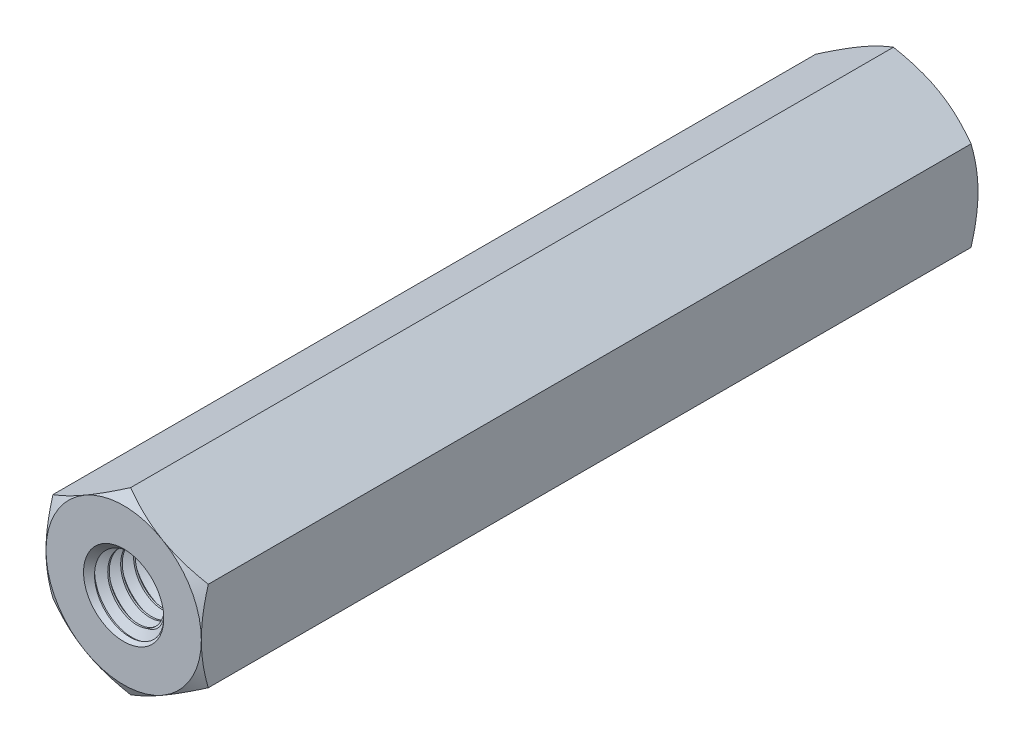
from build123d import *

# Parameters (mm, degrees)
EXTRUDE1_DEPTH          = 15
EXTRUDE1_DEPTH_BACK     = 15
SKETCH1_R               = 1.5
SWEEP1_PITCH            = 0.5
EXTRUDE2_DEPTH          = 31.842512429
SKETCH8_OUTSIDE_W       = 124.676
SKETCH8_OUTSIDE_H       = 125.604
SKETCH8_OUTSIDE_R       = 3
EXTRUDE4_DEPTH          = 31.842512429
EXTRUDE4_DRAFT          = -60
MIRROR1_COPY_1_SKETCH_W = 124.676
MIRROR1_COPY_1_SKETCH_H = 125.604
MIRROR1_COPY_1_SKETCH_R = 3
MIRROR1_COPY_1_DEPTH    = 31.842512429
MIRROR1_COPY_1_DRAFT    = -60
SKETCH9_W               = 17.4
SKETCH9_H               = 1.5508


with BuildPart() as part:
    # Sketch1 → Extrude1 (new, two sides: drawn at the far end of the back side and taken through both)
    with BuildSketch(Plane.XY.offset(-EXTRUDE1_DEPTH_BACK)):
        Polygon((0, 3.464101615), (-3, 1.732050808), (-3, -1.732050808), (0, -3.464101615), (3, -1.732050808), (3, 1.732050808), align=None)
        Circle(SKETCH1_R, mode=Mode.SUBTRACT)
    extrude(amount=EXTRUDE1_DEPTH + EXTRUDE1_DEPTH_BACK)

    # Sweep1: the profile of Sketch12 profile screwed along a right-hand helix of 61 turns, 6 arcs to a turn; built about Z, then put on its axis
    sweep1_z = Axis((0, 0, 0), (0, 0, 1))
    sweep1_corners = [(1.5003, 0, -0.437673205), (1.5003, 0, 0.000173205), (1.175240474, 0, -0.1875), (1.175240474, 0, -0.25)]
    with BuildLine(mode=Mode.PRIVATE) as sweep1_profile:
        Line(sweep1_corners[0], sweep1_corners[1])
        Line(sweep1_corners[1], sweep1_corners[2])
        Line(sweep1_corners[2], sweep1_corners[3])
        Line(sweep1_corners[3], sweep1_corners[0])
    sweep1_cap = Face(sweep1_profile.wire())
    sweep1_turn_angles = [0, 30, 60, 90, 120, 150, 180, 210, 240, 270, 300, 330, 360, 390, 420, 450, 480, 510, 540, 570, 600, 630, 660, 690, 720]
    sweep1_turn_weights = [1, 0.8660254037844387, 1, 0.8660254037844387, 1, 0.8660254037844387, 1, 0.8660254037844387, 1, 0.8660254037844387, 1, 0.8660254037844387, 1, 0.8660254037844387, 1, 0.8660254037844387, 1, 0.8660254037844387, 1, 0.8660254037844387, 1, 0.8660254037844387, 1, 0.8660254037844387, 1]
    sweep1_turn_rails = [Edge.make_bspline([Vector(p[0], p[1], 0).rotate(sweep1_z, sweep1_turn_angles[k]) / sweep1_turn_weights[k] + Vector(0, 0, p[2] + SWEEP1_PITCH * sweep1_turn_angles[k] / 360) for k in range(25)], [0, 0, 0, 1, 1, 2, 2, 3, 3, 4, 4, 5, 5, 6, 6, 7, 7, 8, 8, 9, 9, 10, 10, 11, 11, 12, 12, 12], 2, sweep1_turn_weights) for p in sweep1_corners]
    sweep1_turn_sides = [Face.make_surface_from_curves(sweep1_turn_rails[p[0]], sweep1_turn_rails[p[1]]) for p in [(0, 1), (1, 2), (2, 3), (3, 0)]]
    sweep1_last_angles = [21600, 21630, 21660, 21690, 21720, 21750, 21780, 21810, 21840, 21870, 21900, 21930, 21960]
    sweep1_last_weights = [1, 0.8660254037844387, 1, 0.8660254037844387, 1, 0.8660254037844387, 1, 0.8660254037844387, 1, 0.8660254037844387, 1, 0.8660254037850578, 1]
    sweep1_last_rails = [Edge.make_bspline([Vector(p[0], p[1], 0).rotate(sweep1_z, sweep1_last_angles[k]) / sweep1_last_weights[k] + Vector(0, 0, p[2] + SWEEP1_PITCH * sweep1_last_angles[k] / 360) for k in range(13)], [0, 0, 0, 1, 1, 2, 2, 3, 3, 4, 4, 5, 5, 6, 6, 6], 2, sweep1_last_weights) for p in sweep1_corners]
    sweep1_last_sides = [Face.make_surface_from_curves(sweep1_last_rails[p[0]], sweep1_last_rails[p[1]]) for p in [(0, 1), (1, 2), (2, 3), (3, 0)]]
    sweep1 = Plane(origin=(0, 0, -15), x_dir=(0, 1, 0), z_dir=(0, 0, 1)) * Solid(Shell([*[p.moved(Location((0, 0, 2 * SWEEP1_PITCH * i))) for i in range(30) for p in sweep1_turn_sides], *sweep1_last_sides, sweep1_cap, sweep1_cap.rotate(sweep1_z, 21960).moved(Location((0, 0, SWEEP1_PITCH * 21960 / 360)))]))
    add(sweep1)

    # Sketch6 → Extrude2 (cut, through all)
    with BuildSketch(Plane(origin=(0, 0, -15), x_dir=(-1, 0, 0), z_dir=(0, 0, -1))):
        Polygon((0, 3.464101615), (-3, 1.732050808), (-3, -1.732050808), (0, -3.464101615), (3, -1.732050808), (3, 1.732050808), align=None)
    extrude2 = extrude(amount=EXTRUDE2_DEPTH, mode=Mode.SUBTRACT)

    # Extrude3 cone 1 section (through the dimple's axis) → Extrude3 (revolve, cut)
    with BuildSketch(Plane(origin=(0, 0, -15), x_dir=(0, 1, 0), z_dir=(1, 0, 0))):
        Polygon((0, 0), (1.5508, 0), (0, 1.663029396), align=None)
    extrude3 = revolve(axis=Axis((0, 0, -15), (0, 0, 1)), mode=Mode.SUBTRACT)


with BuildPart() as extrude4_tool:
    # Sketch8 outside → Extrude4 (with draft: the straight prism first)
    with BuildSketch(Plane(origin=(0, 0, -15), x_dir=(-1, 0, 0), z_dir=(0, 0, -1))):
        Rectangle(SKETCH8_OUTSIDE_W, SKETCH8_OUTSIDE_H)
        Circle(SKETCH8_OUTSIDE_R, mode=Mode.SUBTRACT)
    extrude(amount=-EXTRUDE4_DEPTH)
    # Extrude4: the draft: its side faces are tilted about the plane it starts from
    extrude4_sides = [extrude4_tool.faces().sort_by_distance(p)[0] for p in [
        (0, -62.802, 0.921256214),
        (-62.338, 0, 0.921256214),
        (0, 62.802, 0.921256214),
        (62.338, 0, 0.921256214),
        (3, 0, 0.921256214),
    ]]
    draft(extrude4_sides, Plane(origin=(0, 0, -15), x_dir=(-1, 0, 0), z_dir=(0, 0, -1)), EXTRUDE4_DRAFT)


with BuildPart() as part_1:
    add(part.part)

    # Extrude4: cut by extrude4_tool
    add(extrude4_tool.part, mode=Mode.SUBTRACT)

    # Mirror1: Extrude2, Extrude3 across plane
    add(extrude2.mirror(Plane.XY), mode=Mode.SUBTRACT)
    add(extrude3.mirror(Plane.XY), mode=Mode.SUBTRACT)


with BuildPart() as mirror1_copy_1_tool:
    # Mirror1 copy 1 sketch → Mirror1 copy 1 (with draft: the straight prism first)
    with BuildSketch(Plane(origin=(0, 0, 15), x_dir=(-1, 0, 0), z_dir=(0, 0, 1))):
        Rectangle(MIRROR1_COPY_1_SKETCH_W, MIRROR1_COPY_1_SKETCH_H)
        Circle(MIRROR1_COPY_1_SKETCH_R, mode=Mode.SUBTRACT)
    extrude(amount=-MIRROR1_COPY_1_DEPTH)
    # Mirror1 copy 1: the draft: its side faces are tilted about the plane it starts from
    mirror1_copy_1_sides = [mirror1_copy_1_tool.faces().sort_by_distance(p)[0] for p in [
        (0, -62.802, -0.921256214),
        (-62.338, 0, -0.921256214),
        (0, 62.802, -0.921256214),
        (62.338, 0, -0.921256214),
        (3, 0, -0.921256214),
    ]]
    draft(mirror1_copy_1_sides, Plane(origin=(0, 0, 15), x_dir=(-1, 0, 0), z_dir=(0, 0, 1)), MIRROR1_COPY_1_DRAFT)


with BuildPart() as part_2:
    add(part_1.part)

    # Mirror1 copy 1: cut by mirror1_copy_1_tool
    add(mirror1_copy_1_tool.part, mode=Mode.SUBTRACT)

    # Sketch9 → Revolve 2 (revolve)
    with BuildSketch(Plane(origin=(0, 0, 0), x_dir=(0, 0, -1), z_dir=(1, 0, 0)), mode=Mode.PRIVATE) as revolve_2_sk:
        with Locations((0, 0.7754)):
            Rectangle(SKETCH9_W, SKETCH9_H)
    revolve(revolve_2_sk.sketch.rotate(Axis((0, 0, 15), (0, 0, -1)), 270), axis=Axis((0, 0, 15), (0, 0, -1)))


solid = part_2.part
